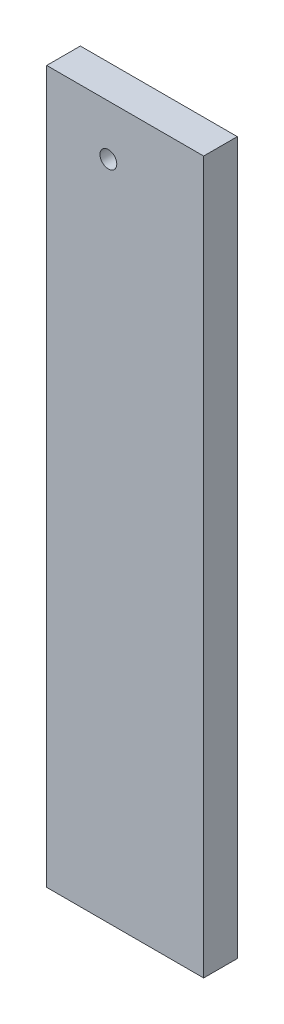
from build123d import *

# Parameters (mm, degrees)
SKETCH1_W               = 88.9
SKETCH1_H               = 403.225
BOSS_EXTRUDE1_DEPTH     = 9.525
CUT_EXTRUDE1_DEPTH      = 208.331389703
CUT_EXTRUDE1_DEPTH_BACK = 208.331389703
SKETCH2_R               = 4.7625


with BuildPart() as part:
    # Sketch1 → Boss-Extrude1 (new, symmetric)
    with BuildSketch(Plane.XY):
        Rectangle(SKETCH1_W, SKETCH1_H)
    extrude(amount=BOSS_EXTRUDE1_DEPTH, both=True)

    # Sketch2 → Cut-Extrude1 (cut, two sides: drawn at the far end of the back side and taken through both)
    with BuildSketch(Plane.XY.offset(9.525).offset(-CUT_EXTRUDE1_DEPTH_BACK)):
        with Locations((-9.525, 173.0375)):
            Circle(SKETCH2_R)
    extrude(amount=CUT_EXTRUDE1_DEPTH + CUT_EXTRUDE1_DEPTH_BACK, mode=Mode.SUBTRACT)


solid = part.part
